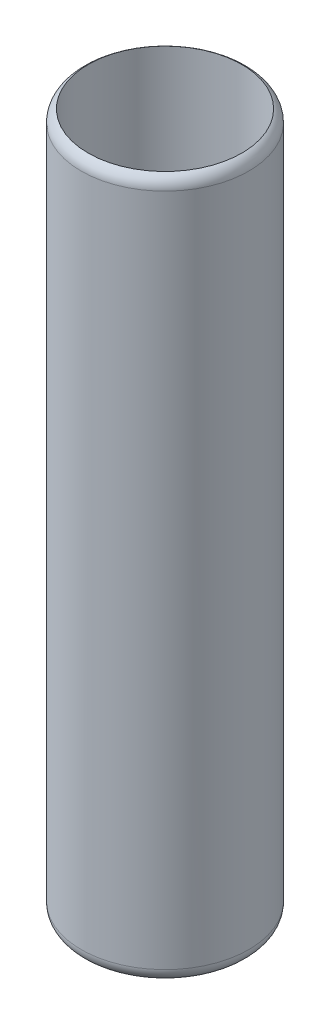
from build123d import *

# Parameters (mm, degrees)
SKETCH1_R           = 6
BOSS_EXTRUDE1_DEPTH = 50
SKETCH2_R           = 5.5
CUT_EXTRUDE1_DEPTH  = 50
FILLET1_R           = 1
FILLET2_R           = 1


with BuildPart() as part:
    # Sketch1 → Boss-Extrude1 (new body)
    with BuildSketch(Plane(origin=(0, 0, 0), x_dir=(1, 0, 0), z_dir=(0, 1, 0))):
        with Locations(Location((0, 0, 0), (0, 0, 270))):
            Circle(SKETCH1_R)
    extrude(amount=BOSS_EXTRUDE1_DEPTH)

    # Sketch2 → Cut-Extrude1 (cut)
    with BuildSketch(Plane(origin=(0, 50, 0), x_dir=(1, 0, 0), z_dir=(0, 1, 0))):
        with Locations(Location((0, 0, 0), (0, 0, 270))):
            Circle(SKETCH2_R)
    extrude(amount=-CUT_EXTRUDE1_DEPTH, mode=Mode.SUBTRACT)

    # Fillet1
    # the kernel refuses this fillet: 1 mm, written as the material it takes off along each edge
    with BuildSketch(Plane(origin=(0, 50, 0), x_dir=(0, 0, 1), z_dir=(-1, 0, 0))) as fillet1_piece_1:
        with BuildLine():
            CenterArc((5, -0.866025404), FILLET1_R, 0, 60)
            Line((5.5, 0), (5.51, 0.017320508))
            ThreePointArc((5.51, 0.017320508), (5.75, 0.02), (6, 0.02))
            Line((6, 0.02), (6.02, 0))
            Line((6.02, 0), (6.02, -0.866025404))
            Line((6.02, -0.866025404), (6, -0.866025404))
        make_face()
    revolve(axis=Axis((0, 50, 0), (0, 1, 0)), mode=Mode.SUBTRACT)

    # Fillet2
    # the kernel refuses this fillet: 1 mm, written as the material it takes off along each edge
    with BuildSketch(Plane(origin=(0, 0, 0), x_dir=(0, 0, 1), z_dir=(-1, 0, 0))) as fillet2_piece_1:
        with BuildLine():
            CenterArc((5, 0.866025404), FILLET2_R, 300, 60)
            Line((5.5, 0), (5.51, -0.017320508))
            ThreePointArc((5.51, -0.017320508), (5.75, -0.02), (6, -0.02))
            Line((6, -0.02), (6.02, 0))
            Line((6.02, 0), (6.02, 0.866025404))
            Line((6.02, 0.866025404), (6, 0.866025404))
        make_face()
    revolve(axis=Axis((0, 0, 0), (0, 1, 0)), mode=Mode.SUBTRACT)


solid = part.part
